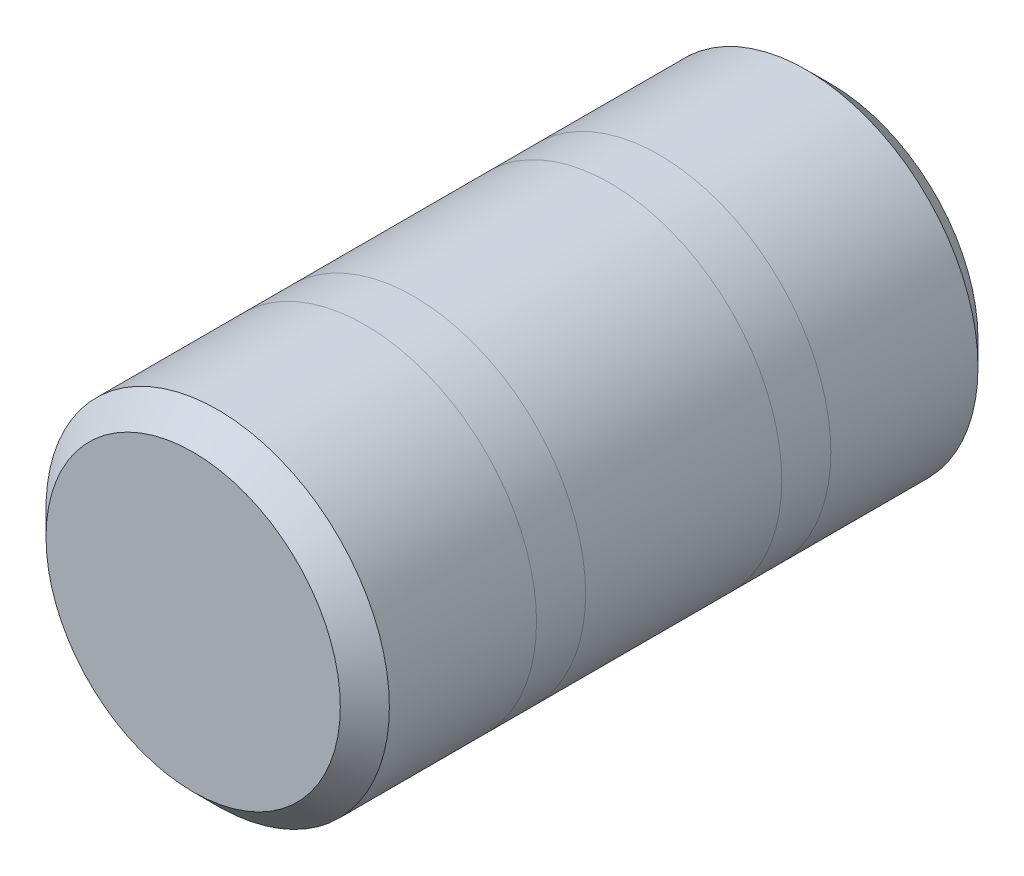
from build123d import *

# Parameters (mm, degrees)
SKETCH1_R           = 17.5
BOSS_EXTRUDE1_DEPTH = 65
CHAMFER1_SIZE       = 2.5


with BuildPart() as part:
    # Sketch1 → Boss-Extrude1 (new body)
    with BuildSketch(Plane.XY):
        Circle(SKETCH1_R)
    extrude(amount=BOSS_EXTRUDE1_DEPTH)

    # Chamfer1
    chamfer1_edges = [part.edges().sort_by_distance(p)[0] for p in [
        (-17.5, 0, 65),
        (-17.5, 0, 0),
    ]]
    chamfer(chamfer1_edges, length=CHAMFER1_SIZE)


solid = part.part
